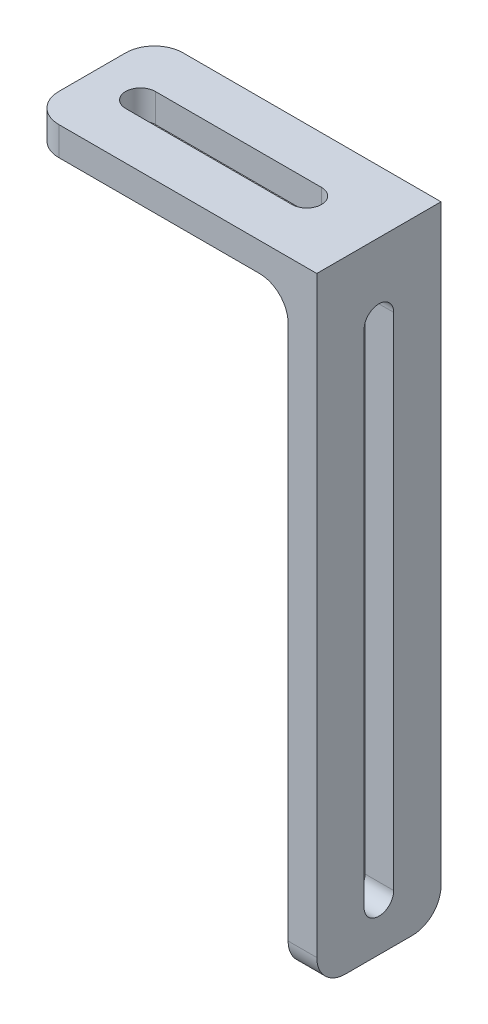
from build123d import *

# Parameters (mm, degrees)
BOSS_EXTRUDE1_DEPTH = 13
CUT_EXTRUDE1_DEPTH  = 73.759879054
CUT_EXTRUDE2_DEPTH  = 72.575135347
FILLET1_R           = 3
FILLET2_R           = 3


with BuildPart() as part:
    # Sketch1 → Boss-Extrude1 (new body)
    with BuildSketch(Plane.XY):
        Polygon((0, 0), (3, 0), (3, 65), (-27, 65), (-27, 62), (0, 62), align=None)
    extrude(amount=BOSS_EXTRUDE1_DEPTH)

    # Sketch6 → Cut-Extrude1 (cut, through all)
    with BuildSketch(Plane(origin=(3, 0, 0), x_dir=(0, 0, -1), z_dir=(1, 0, 0))):
        with BuildLine():
            Line((-4.95, 57.45), (-4.95, 5.05))
            ThreePointArc((-4.95, 5.05), (-6.5, 3.5), (-8.05, 5.05))
            Line((-8.05, 5.05), (-8.05, 57.45))
            ThreePointArc((-8.05, 57.45), (-6.5, 59), (-4.95, 57.45))
        make_face()
    extrude(amount=-CUT_EXTRUDE1_DEPTH, mode=Mode.SUBTRACT)

    # Sketch7 → Cut-Extrude2 (cut, through all)
    with BuildSketch(Plane(origin=(0, 65, 0), x_dir=(1, 0, 0), z_dir=(0, 1, 0))):
        with BuildLine():
            Line((-21.95, -4.95), (-4.55, -4.95))
            ThreePointArc((-4.55, -4.95), (-3, -6.5), (-4.55, -8.05))
            Line((-4.55, -8.05), (-21.95, -8.05))
            ThreePointArc((-21.95, -8.05), (-23.5, -6.5), (-21.95, -4.95))
        make_face()
    extrude(amount=-CUT_EXTRUDE2_DEPTH, mode=Mode.SUBTRACT)

    # Fillet1
    fillet1_edges = [part.edges().sort_by_distance(p)[0] for p in [
        (0, 62, 6.5),
    ]]
    fillet(fillet1_edges, radius=FILLET1_R - 0.0001)  # a hair under: the kernel refuses the full size

    # Fillet2
    fillet2_edges = [part.edges().sort_by_distance(p)[0] for p in [
        (-27, 63.5, 13),
        (-27, 63.5, 0),
        (1.5, 0, 0),
        (1.5, 0, 13),
    ]]
    fillet(fillet2_edges, radius=FILLET2_R)


solid = part.part
